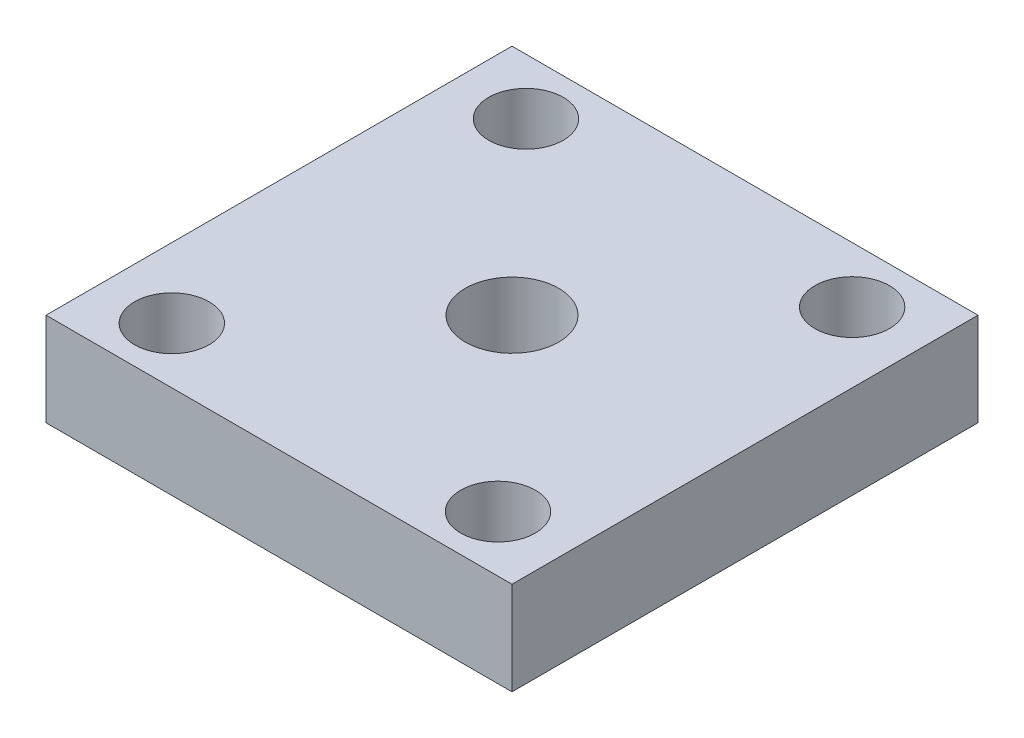
from build123d import *

# Parameters (mm, degrees)
SKETCH1_W           = 50
SKETCH1_H           = 50
SKETCH1_R           = 1.8
SKETCH1_R_2         = 5.01
BOSS_EXTRUDE1_DEPTH = 10
SKETCH2_R           = 4
CUT_EXTRUDE1_DEPTH  = 6


with BuildPart() as part:
    # Sketch1 → Boss-Extrude1 (new body)
    with BuildSketch(Plane(origin=(0, 0, 0), x_dir=(1, 0, 0), z_dir=(0, 1, 0))):
        Rectangle(SKETCH1_W, SKETCH1_H)
        with Locations((-17.5, 19)):
            Circle(SKETCH1_R, mode=Mode.SUBTRACT)
        with Locations((17.5, 19)):
            Circle(SKETCH1_R, mode=Mode.SUBTRACT)
        with Locations((17.5, -19)):
            Circle(SKETCH1_R, mode=Mode.SUBTRACT)
        with Locations((-17.5, -19)):
            Circle(SKETCH1_R, mode=Mode.SUBTRACT)
        Circle(SKETCH1_R_2, mode=Mode.SUBTRACT)
    extrude(amount=BOSS_EXTRUDE1_DEPTH)

    # Sketch2 → Cut-Extrude1 (cut)
    with BuildSketch(Plane(origin=(0, 10, 0), x_dir=(1, 0, 0), z_dir=(0, 1, 0))):
        with Locations((-17.5, 19)):
            Circle(SKETCH2_R)
        with Locations((17.5, 19)):
            Circle(SKETCH2_R)
        with Locations((17.5, -19)):
            Circle(SKETCH2_R)
        with Locations((-17.5, -19)):
            Circle(SKETCH2_R)
    extrude(amount=-CUT_EXTRUDE1_DEPTH, mode=Mode.SUBTRACT)


solid = part.part
